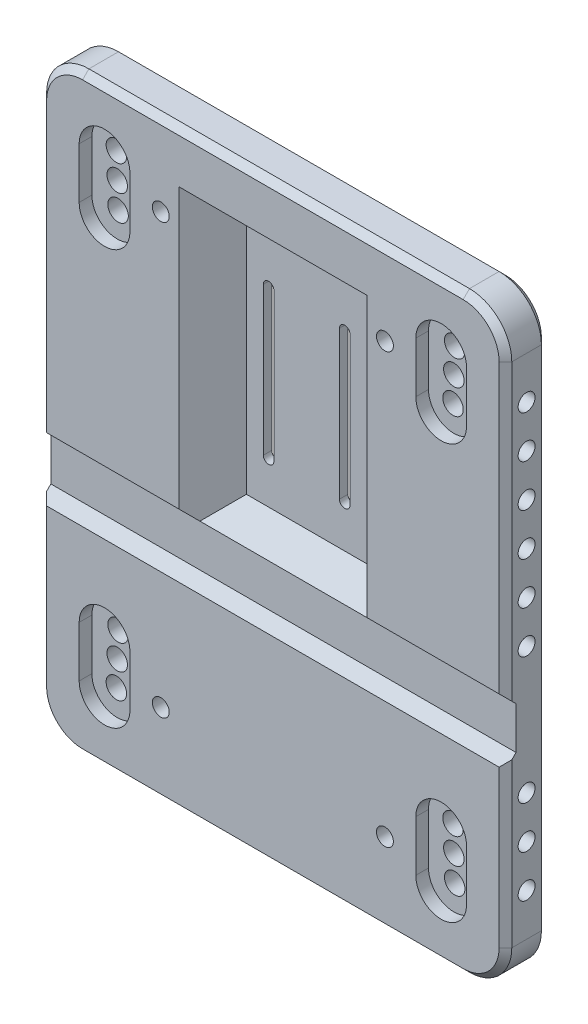
from build123d import *

# Parameters (mm, degrees)
SKETCH1_W           = 110
SKETCH1_H           = 140
SKETCH1_R           = 2
SKETCH1_R_2         = 2.425
BOSS_EXTRUDE1_DEPTH = 10
FILLET1_R           = 10
SKETCH3_W           = 28.5
SKETCH3_H           = 55
CUT_EXTRUDE1_DEPTH  = 8
CHAMFER1_SIZE       = 8
SKETCH5_R           = 2
CUT_EXTRUDE3_DEPTH  = 8
CUT_EXTRUDE4_START  = -8
SKETCH6_R           = 2
CUT_EXTRUDE4_DEPTH  = 8
SKETCH7_W           = 110
SKETCH7_H           = 15
CUT_EXTRUDE7_DEPTH  = 2.5
CHAMFER3_SIZE       = 2.5
CHAMFER4_SIZE       = 1.5
CUT_EXTRUDE8_DEPTH  = 3
BOSS_EXTRUDE3_DEPTH = 10
SKETCH10_W          = 6.9
SKETCH10_H          = 6.9
CUT_EXTRUDE9_DEPTH  = 5
BOSS_EXTRUDE4_DEPTH = 10


with BuildPart() as part:
    # Sketch1 → Boss-Extrude1 (new body)
    with BuildSketch(Plane.XY):
        Rectangle(SKETCH1_W, SKETCH1_H)
        with Locations((-26.5, 50.75)):
            Circle(SKETCH1_R, mode=Mode.SUBTRACT)
        with Locations(Location((26.5, 50.75, 0), (0, 0, 180))):
            Circle(SKETCH1_R, mode=Mode.SUBTRACT)
        with Locations((26.5, -50.75)):
            Circle(SKETCH1_R, mode=Mode.SUBTRACT)
        with Locations(Location((-26.5, -50.75, 0), (0, 0, 180))):
            Circle(SKETCH1_R, mode=Mode.SUBTRACT)
        with Locations((-40, 55)):
            Circle(SKETCH1_R_2, mode=Mode.SUBTRACT)
        with Locations(Location((40, 55, 0), (0, 0, 180))):
            Circle(SKETCH1_R_2, mode=Mode.SUBTRACT)
        with Locations((40, -55)):
            Circle(SKETCH1_R_2, mode=Mode.SUBTRACT)
        with Locations(Location((-40, -55, 0), (0, 0, 180))):
            Circle(SKETCH1_R_2, mode=Mode.SUBTRACT)
        with Locations((-39.8, 49)):
            Circle(SKETCH1_R_2, mode=Mode.SUBTRACT)
        with Locations(Location((39.8, 49, 0), (0, 0, 180))):
            Circle(SKETCH1_R_2, mode=Mode.SUBTRACT)
        with Locations((39.8, -49)):
            Circle(SKETCH1_R_2, mode=Mode.SUBTRACT)
        with Locations(Location((-39.8, -49, 0), (0, 0, 180))):
            Circle(SKETCH1_R_2, mode=Mode.SUBTRACT)
        with Locations((-39.6, 43.00333426)):
            Circle(SKETCH1_R_2, mode=Mode.SUBTRACT)
        with Locations(Location((39.6, 43.00333426, 0), (0, 0, 180))):
            Circle(SKETCH1_R_2, mode=Mode.SUBTRACT)
        with Locations((39.6, -43.00333426)):
            Circle(SKETCH1_R_2, mode=Mode.SUBTRACT)
        with Locations(Location((-39.6, -43.00333426, 0), (0, 0, 180))):
            Circle(SKETCH1_R_2, mode=Mode.SUBTRACT)
        with BuildLine():
            Line((-7.75, 40), (-7.75, 5))
            ThreePointArc((-7.75, 5), (-9, 3.75), (-10.25, 5))
            Line((-10.25, 5), (-10.25, 40))
            ThreePointArc((-10.25, 40), (-9, 41.25), (-7.75, 40))
        make_face(mode=Mode.SUBTRACT)
        with BuildLine():
            Line((7.75, 40), (7.75, 5))
            ThreePointArc((7.75, 5), (9, 3.75), (10.25, 5))
            Line((10.25, 5), (10.25, 40))
            ThreePointArc((10.25, 40), (9, 41.25), (7.75, 40))
        make_face(mode=Mode.SUBTRACT)
    extrude(amount=BOSS_EXTRUDE1_DEPTH)

    # Fillet1
    fillet1_edges = [part.edges().sort_by_distance(p)[0] for p in [
        (55, -70, 5),
        (-55, -70, 5),
        (-55, 70, 5),
        (55, 70, 5),
    ]]
    fillet(fillet1_edges, radius=FILLET1_R)

    # Sketch3 → Cut-Extrude1 (cut)
    with BuildSketch(Plane.XY.offset(10)):
        with Locations((0, 22.5)):
            Rectangle(SKETCH3_W, SKETCH3_H)
    extrude(amount=-CUT_EXTRUDE1_DEPTH, mode=Mode.SUBTRACT)

    # Chamfer1
    chamfer1_edges = [part.edges().sort_by_distance(p)[0] for p in [
        (0, -5, 10),
        (14.25, 22.5, 10),
        (0, 50, 10),
        (-14.25, 22.5, 10),
    ]]
    chamfer(chamfer1_edges, length=CHAMFER1_SIZE - 0.0001)  # a hair under: the kernel refuses the full size

    # Sketch5 → Cut-Extrude3 (cut)
    with BuildSketch(Plane.ZY.offset(55)):
        with Locations(Location((5, 50, 0), (0, 0, 270))):
            Circle(SKETCH5_R)
        with Locations(Location((5, 40, 0), (0, 0, 270))):
            Circle(SKETCH5_R)
        with Locations(Location((5, 30, 0), (0, 0, 270))):
            Circle(SKETCH5_R)
        with Locations(Location((5, 20, 0), (0, 0, 270))):
            Circle(SKETCH5_R)
        with Locations(Location((5, 10, 0), (0, 0, 270))):
            Circle(SKETCH5_R)
        with Locations(Location((5, 0, 0), (0, 0, 270))):
            Circle(SKETCH5_R)
        with Locations(Location((5, -10, 0), (0, 0, 270))):
            Circle(SKETCH5_R)
        with Locations(Location((5, -20, 0), (0, 0, 270))):
            Circle(SKETCH5_R)
        with Locations(Location((5, -30, 0), (0, 0, 270))):
            Circle(SKETCH5_R)
        with Locations(Location((5, -40, 0), (0, 0, 270))):
            Circle(SKETCH5_R)
        with Locations(Location((5, -50, 0), (0, 0, 270))):
            Circle(SKETCH5_R)
    extrude(amount=-CUT_EXTRUDE3_DEPTH, mode=Mode.SUBTRACT)

    # Sketch6 → Cut-Extrude4 (cut)
    with BuildSketch(Plane(origin=(55, 0, 0), x_dir=(0, 0, -1), z_dir=(1, 0, 0)).offset(CUT_EXTRUDE4_START)):
        with Locations(Location((-5, 50, 0), (0, 0, 270))):
            Circle(SKETCH6_R)
        with Locations(Location((-5, 40, 0), (0, 0, 270))):
            Circle(SKETCH6_R)
        with Locations(Location((-5, 30, 0), (0, 0, 270))):
            Circle(SKETCH6_R)
        with Locations(Location((-5, 20, 0), (0, 0, 270))):
            Circle(SKETCH6_R)
        with Locations(Location((-5, 10, 0), (0, 0, 270))):
            Circle(SKETCH6_R)
        with Locations(Location((-5, 0, 0), (0, 0, 270))):
            Circle(SKETCH6_R)
        with Locations(Location((-5, -10, 0), (0, 0, 270))):
            Circle(SKETCH6_R)
        with Locations(Location((-5, -20, 0), (0, 0, 270))):
            Circle(SKETCH6_R)
        with Locations(Location((-5, -30, 0), (0, 0, 270))):
            Circle(SKETCH6_R)
        with Locations(Location((-5, -40, 0), (0, 0, 270))):
            Circle(SKETCH6_R)
        with Locations(Location((-5, -50, 0), (0, 0, 270))):
            Circle(SKETCH6_R)
    extrude(amount=CUT_EXTRUDE4_DEPTH, mode=Mode.SUBTRACT)

    # Sketch7 → Cut-Extrude7 (cut)
    with BuildSketch(Plane.XY.offset(10)):
        with Locations((0, -15.5)):
            Rectangle(SKETCH7_W, SKETCH7_H)
    extrude(amount=-CUT_EXTRUDE7_DEPTH, mode=Mode.SUBTRACT)

    # Chamfer3
    chamfer3_edges = [part.edges().sort_by_distance(p)[0] for p in [
        (0, -23, 7.5),
        (-37.37495, -8, 7.5),
        (37.37495, -8, 7.5),
    ]]
    chamfer(chamfer3_edges, length=CHAMFER3_SIZE - 0.0001)  # a hair under: the kernel refuses the full size

    # Chamfer4
    chamfer4_edges = [part.edges().sort_by_distance(p)[0] for p in [
        (0, -70, 0),
        (0, -70, 10),
        (55, 0, 0),
        (-55, 0, 0),
        (0, 70, 0),
        (52.071067812, 67.071067812, 0),
        (-52.071067812, 67.071067812, 0),
        (52.071067812, -67.071067812, 0),
        (-52.071067812, -67.071067812, 0),
        (-55, 26, 10),
        (55, -41.5, 10),
        (0, 70, 10),
        (52.071067812, 67.071067812, 10),
        (-52.071067812, 67.071067812, 10),
        (52.071067812, -67.071067812, 10),
        (-52.071067812, -67.071067812, 10),
        (-55, -41.5, 10),
        (55, 26, 10),
    ]]
    chamfer(chamfer4_edges, length=CHAMFER4_SIZE)

    # Sketch8 → Cut-Extrude8 (cut)
    with BuildSketch(Plane(origin=(0, 0, 10), x_dir=(-1, 0, 0), z_dir=(0, 0, -1))):
        with BuildLine():
            Line((-45.8, 43), (-45.8, 55))
            ThreePointArc((-45.8, 55), (-39.8, 61), (-33.8, 55))
            Line((-33.8, 55), (-33.8, 43))
            ThreePointArc((-33.8, 43), (-39.8, 37), (-45.8, 43))
        make_face()
        with BuildLine():
            Line((45.8, 43), (45.8, 55))
            ThreePointArc((45.8, 55), (39.8, 61), (33.8, 55))
            Line((33.8, 55), (33.8, 43))
            ThreePointArc((33.8, 43), (39.8, 37), (45.8, 43))
        make_face()
        with BuildLine():
            Line((45.8, -43), (45.8, -55))
            ThreePointArc((45.8, -55), (39.8, -61), (33.8, -55))
            Line((33.8, -55), (33.8, -43))
            ThreePointArc((33.8, -43), (39.8, -37), (45.8, -43))
        make_face()
        with BuildLine():
            Line((-45.8, -43), (-45.8, -55))
            ThreePointArc((-45.8, -55), (-39.8, -61), (-33.8, -55))
            Line((-33.8, -55), (-33.8, -43))
            ThreePointArc((-33.8, -43), (-39.8, -37), (-45.8, -43))
        make_face()
    extrude(amount=CUT_EXTRUDE8_DEPTH, mode=Mode.SUBTRACT)

    # Sketch9 → Boss-Extrude3 (add)
    with BuildSketch(Plane(origin=(55, 0, 0), x_dir=(0, 0, -1), z_dir=(1, 0, 0))):
        Polygon((-7.479483029, -9.130730638), (-5.687930895, -6.827306465), (-2.453830288, -7.571847612), (-2.453830288, -22.439403639), (-6.432472041, -22.439403639), (-7.150561873, -20.576942606), (-7.150561873, -10.503478378), align=None)
    extrude(amount=-BOSS_EXTRUDE3_DEPTH)

    # Sketch10 → Cut-Extrude9 (cut)
    with BuildSketch(Plane(origin=(0, 0, 0), x_dir=(-1, 0, 0), z_dir=(0, 0, -1))):
        with Locations((-26.5, 50.75)):
            Rectangle(SKETCH10_W, SKETCH10_H)
        with Locations((26.5, 50.75)):
            Rectangle(SKETCH10_W, SKETCH10_H)
        with Locations((26.5, -50.75)):
            Rectangle(SKETCH10_W, SKETCH10_H)
        with Locations((-26.5, -50.75)):
            Rectangle(SKETCH10_W, SKETCH10_H)
    extrude(amount=-CUT_EXTRUDE9_DEPTH, mode=Mode.SUBTRACT)

    # Sketch11 → Boss-Extrude4 (add)
    with BuildSketch(Plane.ZY.offset(55)):
        Polygon((2.460121708, -8.614116327), (4.352652236, -6.895389623), (7.133513419, -6.895389623), (7.925286395, -8.961723975), (7.133513419, -10.622516071), (7.133513419, -21.398353157), (5, -22.866029893), (2.711171676, -22.614979925), (2.267006348, -15.044857814), align=None)
    extrude(amount=-BOSS_EXTRUDE4_DEPTH)


solid = part.part
